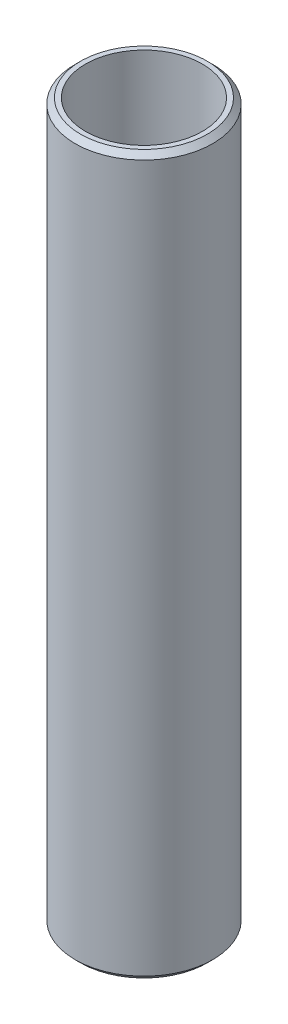
from build123d import *

# Parameters (mm, degrees)
SKETCH1_R           = 57.5
BOSS_EXTRUDE1_DEPTH = 600
SKETCH2_R           = 48.858087815
CUT_EXTRUDE1_DEPTH  = 606.485342515
CHAMFER1_SIZE       = 4.539802674


with BuildPart() as part:
    # Sketch1 → Boss-Extrude1 (new body)
    with BuildSketch(Plane(origin=(0, 0, 0), x_dir=(1, 0, 0), z_dir=(0, 1, 0))):
        Circle(SKETCH1_R)
    extrude(amount=BOSS_EXTRUDE1_DEPTH)

    # Sketch2 → Cut-Extrude1 (cut, through all)
    with BuildSketch(Plane(origin=(0, 0, 0), x_dir=(1, 0, 0), z_dir=(0, 1, 0))):
        Circle(SKETCH2_R)
    extrude(amount=CUT_EXTRUDE1_DEPTH, mode=Mode.SUBTRACT)

    # Chamfer1
    chamfer1_edges = [part.edges().sort_by_distance(p)[0] for p in [
        (-57.5, 600, 0),
        (-57.5, 0, 0),
    ]]
    chamfer(chamfer1_edges, length=CHAMFER1_SIZE)


solid = part.part
